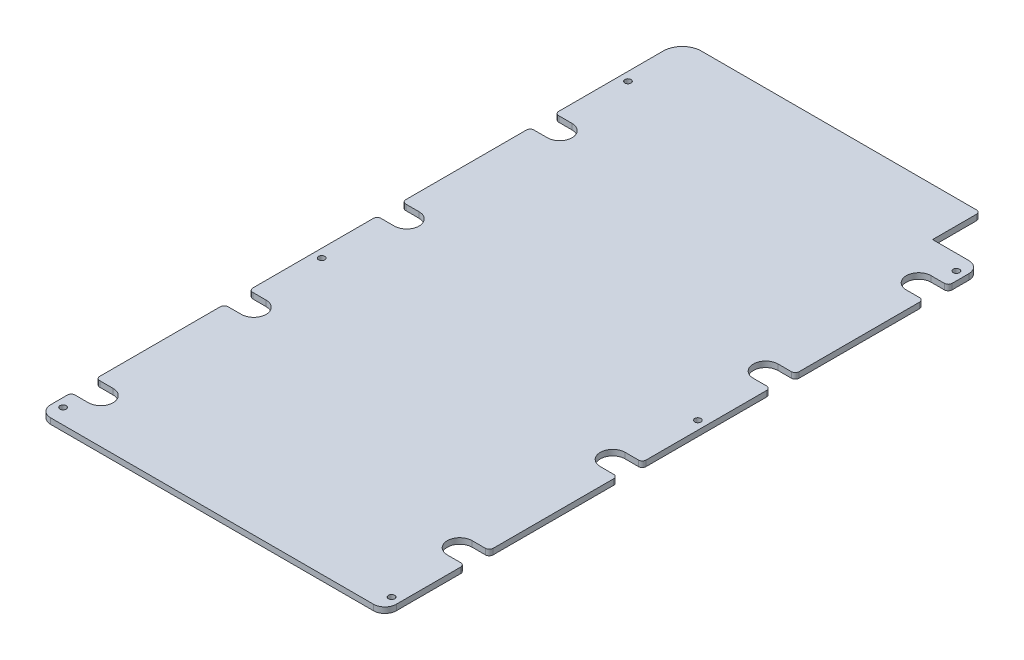
from build123d import *

# Parameters (mm, degrees)
BOSS_EXTRUDE1_DEPTH       = 3
FILLET1_R                 = 10
FILLET2_R                 = 6
F_4_CLEARANCE_HOLE1_D     = 3.2639
F_4_CLEARANCE_HOLE1_DEPTH = 3
F_4_CLEARANCE_HOLE1_TIP   = 0.980574487
FILLET3_R                 = 2


with BuildPart() as part:
    # Sketch1 → Boss-Extrude1 (new body)
    with BuildSketch(Plane(origin=(0, 0, 0), x_dir=(1, 0, 0), z_dir=(0, 1, 0))):
        with BuildLine():
            Line((-90.65, 34.109827366), (-81.65, 34.109827366))
            ThreePointArc((-81.65, 34.109827366), (-75.15, 27.609827366), (-81.65, 21.109827366))
            Line((-81.65, 21.109827366), (-90.65, 21.109827366))
            Line((-90.65, 21.109827366), (-90.65, -46.140172634))
            Line((-90.65, -46.140172634), (-81.65, -46.140172634))
            ThreePointArc((-81.65, -46.140172634), (-75.15, -52.640172634), (-81.65, -59.140172634))
            Line((-81.65, -59.140172634), (-90.65, -59.140172634))
            Line((-90.65, -59.140172634), (-90.65, -126.390172634))
            Line((-90.65, -126.390172634), (-81.65, -126.390172634))
            ThreePointArc((-81.65, -126.390172634), (-75.15, -132.890172634), (-81.65, -139.390172634))
            Line((-81.65, -139.390172634), (-90.65, -139.390172634))
            Line((-90.65, -139.390172634), (-90.65, -156.140172634))
            Line((-90.65, -156.140172634), (90.65, -156.140172634))
            Line((90.65, -156.140172634), (90.65, -114.390172634))
            Line((90.65, -114.390172634), (81.65, -114.390172634))
            ThreePointArc((81.65, -114.390172634), (75.15, -107.890172634), (81.65, -101.390172634))
            Line((81.65, -101.390172634), (90.65, -101.390172634))
            Line((90.65, -101.390172634), (90.65, -34.140172634))
            Line((90.65, -34.140172634), (81.65, -34.140172634))
            ThreePointArc((81.65, -34.140172634), (75.15, -27.640172634), (81.65, -21.140172634))
            Line((81.65, -21.140172634), (90.65, -21.140172634))
            Line((90.65, -21.140172634), (90.65, 46.109827366))
            Line((90.65, 46.109827366), (81.65, 46.109827366))
            ThreePointArc((81.65, 46.109827366), (75.15, 52.609827366), (81.65, 59.109827366))
            Line((81.65, 59.109827366), (90.65, 59.109827366))
            Line((90.65, 59.109827366), (90.65, 126.359827366))
            Line((90.65, 126.359827366), (81.65, 126.359827366))
            ThreePointArc((81.65, 126.359827366), (75.15, 132.859827366), (81.65, 139.359827366))
            Line((81.65, 139.359827366), (90.65, 139.359827366))
            Line((90.65, 139.359827366), (90.65, 156.140172634))
            Line((90.65, 156.140172634), (65.65, 156.140172634))
            Line((65.65, 156.140172634), (65.65, 181.140172634))
            Line((65.65, 181.140172634), (-90.65, 181.140172634))
            Line((-90.65, 181.140172634), (-90.65, 114.359827366))
            Line((-90.65, 114.359827366), (-81.65, 114.359827366))
            ThreePointArc((-81.65, 114.359827366), (-75.15, 107.859827366), (-81.65, 101.359827366))
            Line((-81.65, 101.359827366), (-90.65, 101.359827366))
            Line((-90.65, 101.359827366), (-90.65, 34.109827366))
        make_face()
    extrude(amount=BOSS_EXTRUDE1_DEPTH)

    # Fillet1
    fillet1_edges = [part.edges().sort_by_distance(p)[0] for p in [
        (-90.65, 1.5, -181.140172634),
    ]]
    fillet(fillet1_edges, radius=FILLET1_R)

    # Fillet2
    fillet2_edges = [part.edges().sort_by_distance(p)[0] for p in [
        (90.65, 1.5, 156.140172634),
        (-90.65, 1.5, 156.140172634),
        (90.65, 1.5, -156.140172634),
    ]]
    fillet(fillet2_edges, radius=FILLET2_R)

    # #4 Clearance Hole1
    with Locations(Plane(origin=(0, 3, 0), x_dir=(1, 0, 0), z_dir=(0, 1, 0))):
        with Locations((86.15, 148.140172634), (-86.15, -148.140172634), (-86.15, -12.515172634), (-86.15, 148.140172634), (86.15, 12.484827366), (86.15, -148.140172634)):
            Hole(F_4_CLEARANCE_HOLE1_D / 2, depth=F_4_CLEARANCE_HOLE1_DEPTH)
            with Locations((0, 0, -(F_4_CLEARANCE_HOLE1_DEPTH + F_4_CLEARANCE_HOLE1_TIP / 2))):  # 118° drill point
                Cone(0, F_4_CLEARANCE_HOLE1_D / 2, F_4_CLEARANCE_HOLE1_TIP, mode=Mode.SUBTRACT)

    # Fillet3
    fillet3_edges = [part.edges().sort_by_distance(p)[0] for p in [
        (-90.65, 1.5, -101.359827366),
        (-90.65, 1.5, -114.359827366),
        (-90.65, 1.5, -21.109827366),
        (-90.65, 1.5, -34.109827366),
        (-90.65, 1.5, 59.140172634),
        (-90.65, 1.5, 46.140172634),
        (-90.65, 1.5, 139.390172634),
        (-90.65, 1.5, 126.390172634),
        (90.65, 1.5, 101.390172634),
        (90.65, 1.5, 114.390172634),
        (90.65, 1.5, 34.140172634),
        (90.65, 1.5, 21.140172634),
        (90.65, 1.5, -46.109827366),
        (90.65, 1.5, -59.109827366),
        (90.65, 1.5, -126.359827366),
        (90.65, 1.5, -139.359827366),
        (65.65, 1.5, -181.140172634),
    ]]
    fillet(fillet3_edges, radius=FILLET3_R)


solid = part.part
